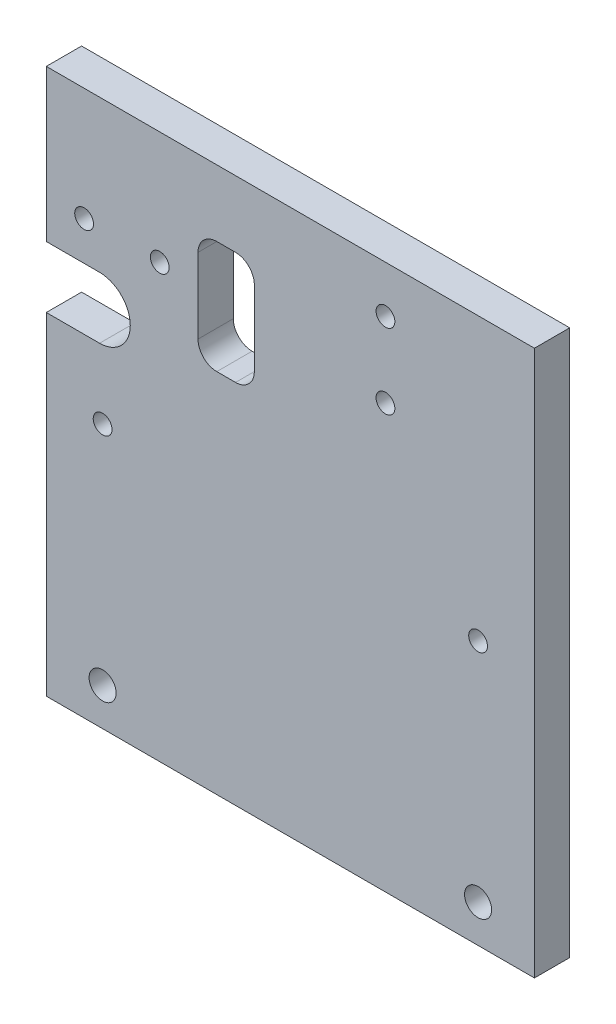
from build123d import *

# Parameters (mm, degrees)
SKETCH1_W           = 130
SKETCH1_H           = 145.26
SKETCH1_R           = 3.6
SKETCH1_R_2         = 2.5
BOSS_EXTRUDE1_DEPTH = 9.4
SKETCH2_R           = 2.5
CUT_EXTRUDE1_DEPTH  = 178.788153711
CUT_EXTRUDE2_DEPTH  = 178.788153711
CUT_EXTRUDE3_DEPTH  = 178.788153711
SKETCH5_R           = 2.5
CUT_EXTRUDE4_DEPTH  = 178.788153711


with BuildPart() as part:
    # Sketch1 → Boss-Extrude1 (new body)
    with BuildSketch(Plane.XY):
        with Locations((50, 62.63)):
            Rectangle(SKETCH1_W, SKETCH1_H)
        Circle(SKETCH1_R, mode=Mode.SUBTRACT)
        with Locations((0, 60.26)):
            Circle(SKETCH1_R_2, mode=Mode.SUBTRACT)
        with Locations((100, 60.26)):
            Circle(SKETCH1_R_2, mode=Mode.SUBTRACT)
        with Locations((100, 0)):
            Circle(SKETCH1_R, mode=Mode.SUBTRACT)
    extrude(amount=BOSS_EXTRUDE1_DEPTH)

    # Sketch2 → Cut-Extrude1 (cut, through all)
    with BuildSketch(Plane.XY.offset(9.4)):
        with Locations((75.33, 122.766411568)):
            Circle(SKETCH2_R)
        with Locations((75.33, 102.766411568)):
            Circle(SKETCH2_R)
    extrude(amount=-CUT_EXTRUDE1_DEPTH, mode=Mode.SUBTRACT)

    # Sketch3 → Cut-Extrude2 (cut, through all)
    with BuildSketch(Plane(origin=(0, 0, 0), x_dir=(-1, 0, 0), z_dir=(0, 0, -1))):
        with BuildLine():
            Line((-35.40754614, 117.570367495), (-30.40754614, 117.570367495))
            ThreePointArc((-30.40754614, 117.570367495), (-26.872012234, 116.105901401), (-25.40754614, 112.570367495))
            Line((-25.40754614, 112.570367495), (-25.40754614, 92.570367495))
            ThreePointArc((-25.40754614, 92.570367495), (-26.872012234, 89.034833589), (-30.40754614, 87.570367495))
            Line((-30.40754614, 87.570367495), (-35.40754614, 87.570367495))
            ThreePointArc((-35.40754614, 87.570367495), (-38.943080046, 89.034833589), (-40.40754614, 92.570367495))
            Line((-40.40754614, 92.570367495), (-40.40754614, 112.570367495))
            ThreePointArc((-40.40754614, 112.570367495), (-38.943080046, 116.105901401), (-35.40754614, 117.570367495))
        make_face()
    extrude(amount=-CUT_EXTRUDE2_DEPTH, mode=Mode.SUBTRACT)

    # Sketch4 → Cut-Extrude3 (cut, through all)
    with BuildSketch(Plane.XY.offset(9.4)):
        with BuildLine():
            Line((-15, 78.5), (-15, 94.86))
            Line((-15, 94.86), (-0.81, 94.86))
            ThreePointArc((-0.81, 94.86), (7.37, 86.68), (-0.81, 78.5))
            Line((-0.81, 78.5), (-15, 78.5))
        make_face()
    extrude(amount=-CUT_EXTRUDE3_DEPTH, mode=Mode.SUBTRACT)

    # Sketch5 → Cut-Extrude4 (cut, through all)
    with BuildSketch(Plane.XY.offset(9.4)):
        with Locations((-4.926856845, 105.186)):
            Circle(SKETCH5_R)
        with Locations((15.215343155, 105.186000001)):
            Circle(SKETCH5_R)
    extrude(amount=-CUT_EXTRUDE4_DEPTH, mode=Mode.SUBTRACT)


solid = part.part
